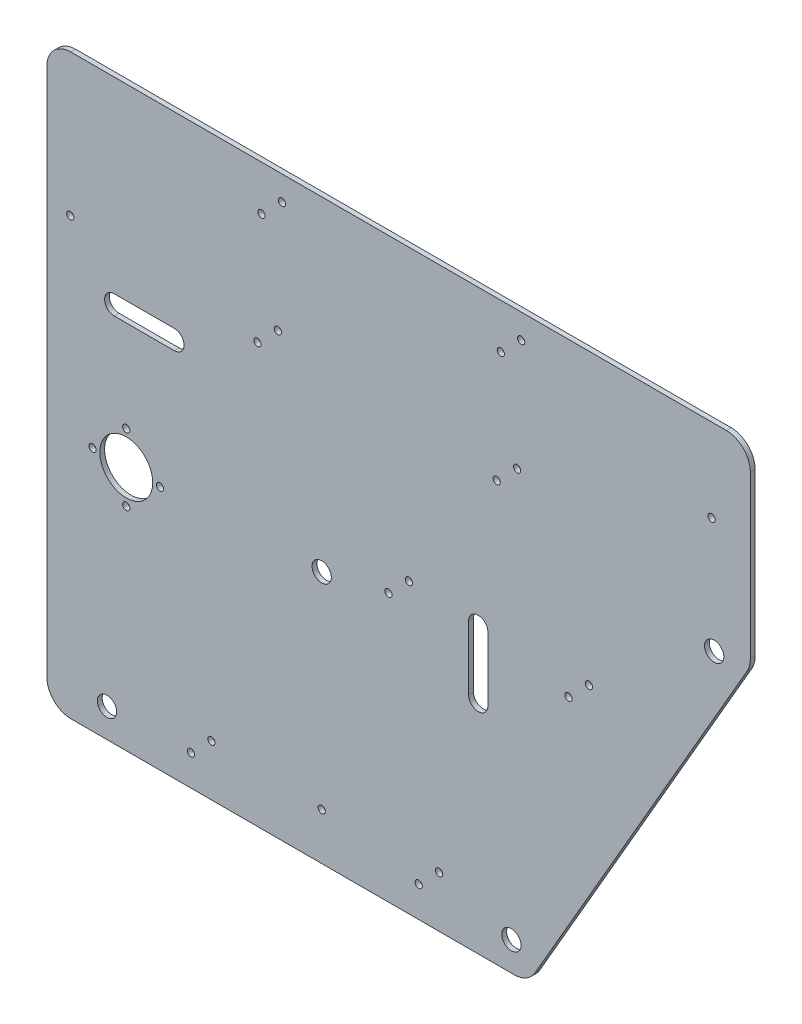
from build123d import *

# Parameters (mm, degrees)
BOSS_EXTRUDE1_DEPTH = 2
SKETCH2_R           = 4
SKETCH2_R_2         = 11
SKETCH2_R_3         = 1.5
CUT_EXTRUDE1_DEPTH  = 3
SKETCH4_W           = 292.37604307
SKETCH4_H           = 50
BOSS_EXTRUDE2_DEPTH = 2
FILLET1_R           = 10
SKETCH5_R           = 1.5
CUT_EXTRUDE2_DEPTH  = 11


with BuildPart() as part:
    # Sketch1 → Boss-Extrude1 (new body)
    with BuildSketch(Plane.XY):
        Polygon((-100, 110), (-100, -80), (100, -80), (192.37604307, 80), (192.37604307, 110), align=None)
    extrude(amount=BOSS_EXTRUDE1_DEPTH)

    # Sketch2 → Cut-Extrude1 (cut)
    with BuildSketch(Plane.XY.offset(2)):
        with Locations((93.07179677, -68)):
            Circle(SKETCH2_R)
        with Locations((177.364936071, 78)):
            Circle(SKETCH2_R)
        with Locations((-67, 22)):
            Circle(SKETCH2_R_2)
        with Locations((-75, -68)):
            Circle(SKETCH2_R)
        with Locations((-53, 22)):
            Circle(SKETCH2_R_3)
        with Locations((-67, 36)):
            Circle(SKETCH2_R_3)
        with Locations((-81, 22)):
            Circle(SKETCH2_R_3)
        with Locations((-67, 8)):
            Circle(SKETCH2_R_3)
        with Locations((54.54952947, -67.242640687)):
            Circle(SKETCH2_R_3)
        with Locations((63.034810844, -58.757359313)):
            Circle(SKETCH2_R_3)
        with Locations((14.225855729, -60.5)):
            Circle(SKETCH2_R_3)
        with Locations((-40.127135228, -67.242640687)):
            Circle(SKETCH2_R_3)
        with Locations((-31.641853854, -58.757359313)):
            Circle(SKETCH2_R_3)
        with Locations((-90.295627115, 101.024345032)):
            Circle(SKETCH2_R_3)
        with Locations((-12.482801161, 94.281704345)):
            Circle(SKETCH2_R_3)
        with Locations((-3.997519787, 102.76698572)):
            Circle(SKETCH2_R_3)
        with Locations((86.965374539, 94.281704345)):
            Circle(SKETCH2_R_3)
        with Locations((95.450655913, 102.76698572)):
            Circle(SKETCH2_R_3)
        with Locations((41.969500075, 31.281704345)):
            Circle(SKETCH2_R_3)
        with Locations((50.454781449, 39.76698572)):
            Circle(SKETCH2_R_3)
        with Locations((116.811272287, 31.281704345)):
            Circle(SKETCH2_R_3)
        with Locations((125.296553661, 39.76698572)):
            Circle(SKETCH2_R_3)
        with Locations((14.225855729, 25)):
            Circle(SKETCH2_R)
        with Locations((176.305585362, 125.488938255)):
            Circle(SKETCH2_R_3)
        with Locations((-10.779061289, 141.344164528)):
            Circle(SKETCH2_R_3)
        with Locations((-2.293779915, 149.829445902)):
            Circle(SKETCH2_R_3)
        with Locations((88.669114411, 141.344164528)):
            Circle(SKETCH2_R_3)
        with Locations((97.154395785, 149.829445902)):
            Circle(SKETCH2_R_3)
        with BuildLine():
            Line((75.290389443, 11.241781095), (75.290389443, 37.908558601))
            ThreePointArc((75.290389443, 37.908558601), (79.290389443, 41.908558601), (83.290389443, 37.908558601))
            Line((83.290389443, 37.908558601), (83.290389443, 11.241781095))
            ThreePointArc((83.290389443, 11.241781095), (79.290389443, 7.241781095), (75.290389443, 11.241781095))
        make_face()
        with BuildLine():
            Line((-72, 82), (-47, 82))
            ThreePointArc((-47, 82), (-43, 78), (-47, 74))
            Line((-47, 74), (-72, 74))
            ThreePointArc((-72, 74), (-76, 78), (-72, 82))
        make_face()
    extrude(amount=-CUT_EXTRUDE1_DEPTH, mode=Mode.SUBTRACT)

    # Sketch4 → Boss-Extrude2 (add)
    with BuildSketch(Plane.XY.offset(2)):
        with Locations((46.188021535, 135)):
            Rectangle(SKETCH4_W, SKETCH4_H)
    extrude(amount=-BOSS_EXTRUDE2_DEPTH)

    # Fillet1
    fillet1_edges = [part.edges().sort_by_distance(p)[0] for p in [
        (192.37604307, 160, 1),
        (192.37604307, 80, 1),
        (100, -80, 1),
        (-100, -80, 1),
        (-100, 160, 1),
    ]]
    fillet(fillet1_edges, radius=FILLET1_R)

    # Sketch5 → Cut-Extrude2 (cut)
    with BuildSketch(Plane.XY.offset(2)):
        with Locations((-10.779061289, 141.344164528)):
            Circle(SKETCH5_R)
        with Locations((-2.293779915, 149.829445902)):
            Circle(SKETCH5_R)
        with Locations((88.669114411, 141.344164528)):
            Circle(SKETCH5_R)
        with Locations((97.154395785, 149.829445902)):
            Circle(SKETCH5_R)
        with Locations((176.305585362, 125.488938255)):
            Circle(SKETCH5_R)
    extrude(amount=-CUT_EXTRUDE2_DEPTH, mode=Mode.SUBTRACT)


solid = part.part
